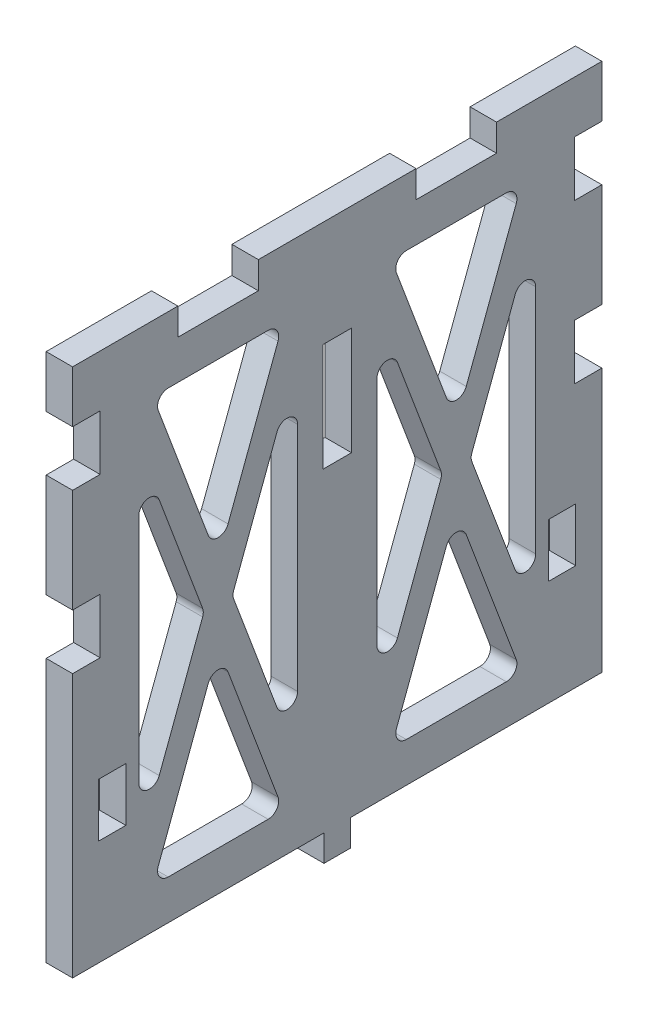
from build123d import *

# Parameters (mm, degrees)
SKETCH4_W           = 6.5024
SKETCH4_H           = 12.8524
SKETCH4_W_2         = 6.858
SKETCH4_H_2         = 25.908
BOSS_EXTRUDE1_DEPTH = 6.35
CUT_EXTRUDE1_DEPTH  = 150.225
FILLET1_R           = 2.54


with BuildPart() as part:
    # Sketch4 → Boss-Extrude1 (new body)
    with BuildSketch(Plane(origin=(0, 0, 0), x_dir=(0, 0, -1), z_dir=(1, 0, 0))):
        Polygon((-60.325, 6.35), (0, 6.35), (0, 0), (6.35, 0), (6.35, 6.35), (66.675, 6.35), (66.675, 32.004), (66.675, 44.704), (66.675, 69.596), (60.071, 69.596), (60.071, 82.804), (66.675, 82.804), (66.675, 107.696), (60.071, 107.696), (60.071, 120.904), (66.675, 120.904), (66.675, 133.35), (41.402, 133.35), (41.402, 126.873), (22.098, 126.873), (22.098, 133.35), (-15.748, 133.35), (-15.748, 126.873), (-35.052, 126.873), (-35.052, 133.35), (-60.325, 133.35), (-60.325, 120.904), (-53.721, 120.904), (-53.721, 107.696), (-60.325, 107.696), (-60.325, 82.804), (-53.721, 82.804), (-53.721, 69.596), (-60.325, 69.596), (-60.325, 44.704), (-60.325, 32.004), align=None)
        with Locations((-50.8, 38.1)):
            Rectangle(SKETCH4_W, SKETCH4_H, mode=Mode.SUBTRACT)
        with Locations((57.15, 38.1)):
            Rectangle(SKETCH4_W, SKETCH4_H, mode=Mode.SUBTRACT)
        with Locations((3.175, 94.996)):
            Rectangle(SKETCH4_W_2, SKETCH4_H_2, mode=Mode.SUBTRACT)
    extrude(amount=BOSS_EXTRUDE1_DEPTH)

    # Sketch5 → Cut-Extrude1 (cut, through all)
    with BuildSketch(Plane(origin=(6.35, 0, 0), x_dir=(0, 0, -1), z_dir=(1, 0, 0))):
        Polygon((-9.740901486, 117.475), (-41.059098514, 117.475), (-25.4, 75.717403964), align=None)
        Polygon((-28.790901486, 66.675), (-44.45, 108.432596036), (-44.45, 24.917403964), align=None)
        Polygon((-6.35, 108.432596036), (-22.009098514, 66.675), (-6.35, 24.917403964), align=None)
        Polygon((-9.740901486, 15.875), (-25.4, 57.632596036), (-41.059098514, 15.875), align=None)
        Polygon((47.409098514, 117.475), (16.090901486, 117.475), (31.75, 75.717403964), align=None)
        Polygon((28.359098514, 66.675), (12.7, 108.432596036), (12.7, 24.917403964), align=None)
        Polygon((50.8, 108.432596036), (35.140901486, 66.675), (50.8, 24.917403964), align=None)
        Polygon((47.409098514, 15.875), (31.75, 57.632596036), (16.090901486, 15.875), align=None)
    extrude(amount=-CUT_EXTRUDE1_DEPTH, mode=Mode.SUBTRACT)

    # Fillet1
    fillet1_edges = [part.edges().sort_by_distance(p)[0] for p in [
        (3.175, 57.632596036, 25.4),
        (3.175, 15.875, 9.740901486),
        (3.175, 15.875, 41.059098514),
        (3.175, 108.432596036, 6.35),
        (3.175, 24.917403964, 6.35),
        (3.175, 66.675, 22.009098514),
        (3.175, 57.632596036, -31.75),
        (3.175, 15.875, -47.409098514),
        (3.175, 15.875, -16.090901486),
        (3.175, 66.675, -35.140901486),
        (3.175, 108.432596036, -50.8),
        (3.175, 24.917403964, -50.8),
        (3.175, 66.675, 28.790901486),
        (3.175, 24.917403964, 44.45),
        (3.175, 108.432596036, 44.45),
        (3.175, 117.475, -16.090901486),
        (3.175, 117.475, -47.409098514),
        (3.175, 75.717403964, -31.75),
        (3.175, 117.475, 9.740901486),
        (3.175, 75.717403964, 25.4),
        (3.175, 108.432596036, -12.7),
        (3.175, 66.675, -28.359098514),
        (3.175, 24.917403964, -12.7),
        (3.175, 117.475, 41.059098514),
    ]]
    fillet(fillet1_edges, radius=FILLET1_R)


solid = part.part
